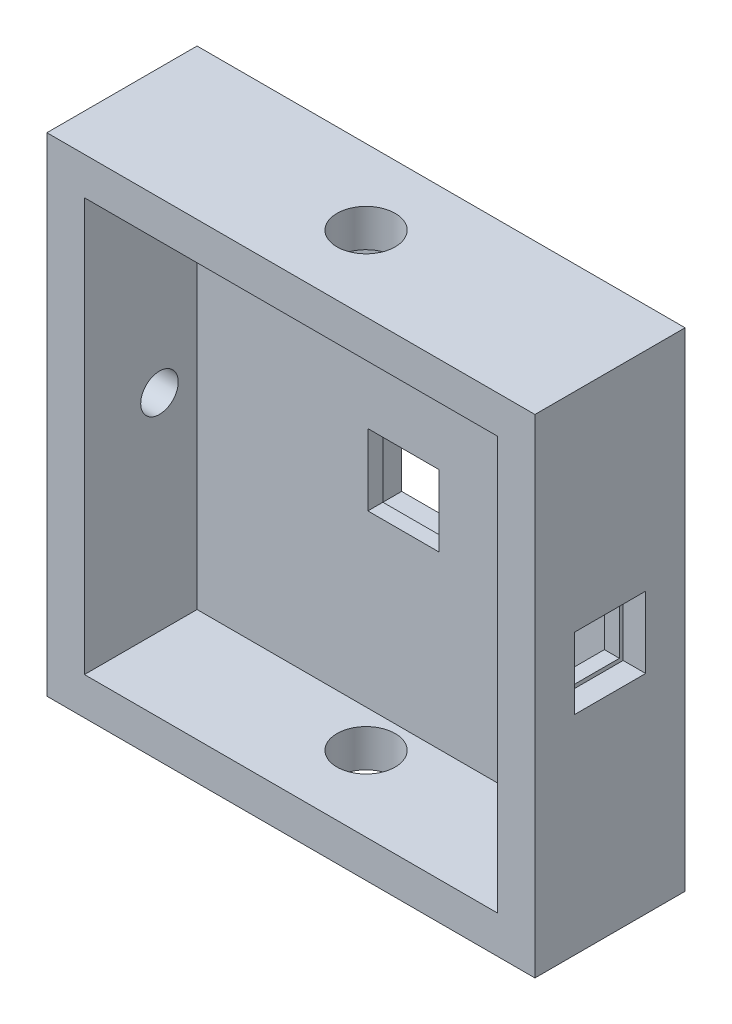
from build123d import *

# Parameters (mm, degrees)
SKETCH1_W            = 26
SKETCH1_H            = 26
SKETCH1_W_2          = 22
SKETCH1_H_2          = 22
BOSS_EXTRUDE16_DEPTH = 8
SKETCH1_5_W          = 22
SKETCH1_5_H          = 22
BOSS_EXTRUDE17_DEPTH = 2
SKETCH4_W            = 4.2
SKETCH4_H            = 4.2
CUT_EXTRUDE3_DEPTH   = 1.2
SKETCH8_W            = 3.8
SKETCH8_H            = 3.8
CUT_EXTRUDE4_DEPTH   = 2
HOLE2_START          = -13
HOLE2_OUTLINE_R      = 1.55
HOLE2_DEPTH          = 26
HOLE4_START          = -13
HOLE4_OUTLINE_R      = 1
HOLE4_DEPTH          = 2
SKETCH15_W           = 3.4
SKETCH15_H           = 3.4
CUT_EXTRUDE25_DEPTH  = 2
SKETCH15_6_W         = 3.8
SKETCH15_6_H         = 3.8
SKETCH15_6_W_2       = 3.4
SKETCH15_6_H_2       = 3.4
CUT_EXTRUDE26_DEPTH  = 1.2


# Read off the part's stored shape, not the designer's step: Hole2, Hole4
with BuildPart() as part:
    # Sketch1 → Boss-Extrude16 (new body)
    with BuildSketch(Plane.XY):
        Rectangle(SKETCH1_W, SKETCH1_H)
        Rectangle(SKETCH1_W_2, SKETCH1_H_2, mode=Mode.SUBTRACT)
    extrude(amount=BOSS_EXTRUDE16_DEPTH)

    # Sketch1<5> → Boss-Extrude17 (add)
    with BuildSketch(Plane.XY):
        Rectangle(SKETCH1_5_W, SKETCH1_5_H)
    extrude(amount=BOSS_EXTRUDE17_DEPTH)

    # Sketch4 → Cut-Extrude3 (cut)
    with BuildSketch(Plane.XY):
        Rectangle(SKETCH4_W, SKETCH4_H)
    extrude(amount=CUT_EXTRUDE3_DEPTH, mode=Mode.SUBTRACT)

    # Sketch8 → Cut-Extrude4 (cut)
    with BuildSketch(Plane(origin=(0, 0, 1.2), x_dir=(-1, 0, 0), z_dir=(0, 0, -1))):
        Rectangle(SKETCH8_W, SKETCH8_H)
    extrude(amount=-CUT_EXTRUDE4_DEPTH, mode=Mode.SUBTRACT)

    # Hole2 outline → Hole2 (cut)
    with BuildSketch(Plane(origin=(0, 0, 0), x_dir=(1, 0, 0), z_dir=(0, 1, 0)).offset(HOLE2_START)):
        with Locations((-0.00435538, -3.992237836)):
            Circle(HOLE2_OUTLINE_R)
    extrude(amount=HOLE2_DEPTH, mode=Mode.SUBTRACT)

    # Hole4 outline → Hole4 (cut)
    with BuildSketch(Plane.YZ.offset(HOLE4_START)):
        with Locations((0.004397166, 4.002298356)):
            Circle(HOLE4_OUTLINE_R)
    extrude(amount=HOLE4_DEPTH, mode=Mode.SUBTRACT)

    # Sketch15 → Cut-Extrude25 (cut)
    with BuildSketch(Plane(origin=(13, 0, 0), x_dir=(0, 0, -1), z_dir=(1, 0, 0))):
        with Locations((-4, 0)):
            Rectangle(SKETCH15_W, SKETCH15_H)
    extrude(amount=-CUT_EXTRUDE25_DEPTH, mode=Mode.SUBTRACT)

    # Sketch15<6> → Cut-Extrude26 (cut)
    with BuildSketch(Plane(origin=(13, 0, 0), x_dir=(0, 0, -1), z_dir=(1, 0, 0))):
        with Locations((-4, 0)):
            Rectangle(SKETCH15_6_W, SKETCH15_6_H)
        with Locations((-4, 0)):
            Rectangle(SKETCH15_6_W_2, SKETCH15_6_H_2, mode=Mode.SUBTRACT)
    extrude(amount=-CUT_EXTRUDE26_DEPTH, mode=Mode.SUBTRACT)


solid = part.part
